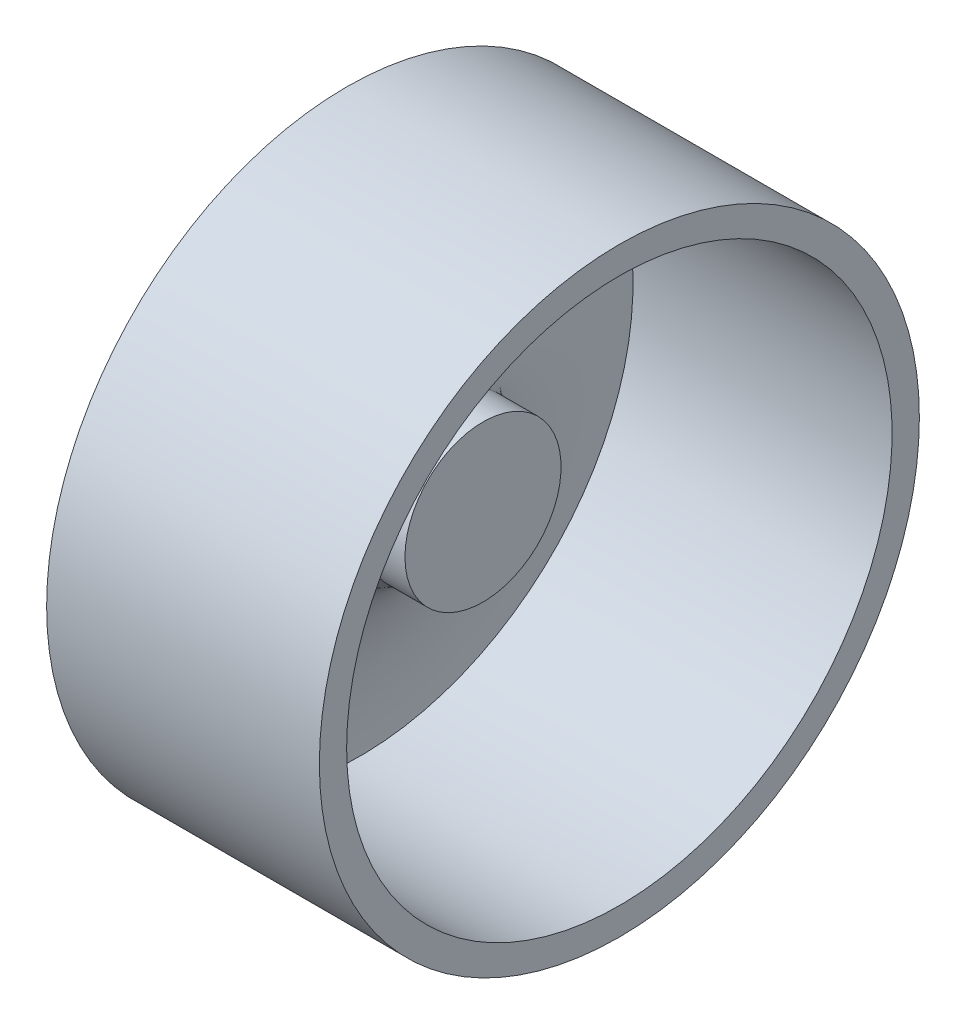
from build123d import *


with BuildPart() as part:
    # Sketch2 → Main Revolve (revolve)
    with BuildSketch(Plane(origin=(0, 0, 0), x_dir=(1, 0, 0), z_dir=(0, 1, 0))):
        with BuildLine():
            Line((-3.81, 0), (0, 0))
            Line((0, 0), (0, 6))
            Line((0, 6), (0, 7.27))
            Line((0, 7.27), (-3.81, 7.27))
            add(Edge.make_bspline(
                [(-11.43, 25.4), (-11.63985212, 16.185984948), (-9.577624941, 8.522957632), (-3.81, 7.27)],
                knots=[0, 0, 0, 0, 1, 1, 1, 1], degree=3))
            Line((-11.43, 25.4), (12.7, 25.4))
            Line((12.7, 25.4), (12.7, 27.94))
            Line((12.7, 27.94), (-12.7, 27.94))
            Line((-12.7, 27.94), (-12.7, 25.4))
            add(Edge.make_bspline(
                [(-4.318, 6.089419633), (-12.85906141, 7.336688862), (-12.7, 25.4)],
                knots=[0, 0, 0, 1, 1, 1], degree=2))
            Line((-4.318, 6.089419633), (-4.318, 0))
            Line((-4.318, 0), (-3.81, 0))
        make_face()
    revolve(axis=Axis((-3.81, 0, 0), (1, 0, 0)))


solid = part.part
